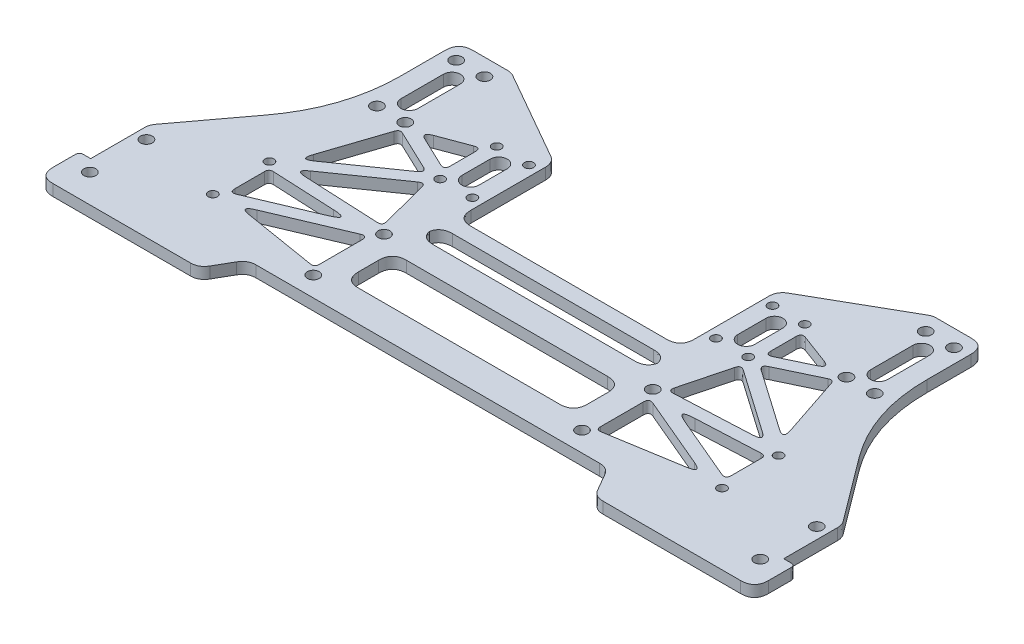
from build123d import *

# Parameters (mm, degrees)
SKETCH_1_W           = 186
SKETCH_1_H           = 115
SKETCH_1_R           = 2.1
EXTRUDE_1_DEPTH      = 4
SKETCH_2_R           = 2.1
CUT_EXTRUDE_1_DEPTH  = 219.716711753
CUT_EXTRUDE_2_DEPTH  = 219.716711753
SKETCH_6_R           = 1.6
SKETCH_6_W           = 73.2
SKETCH_6_H           = 45.2
CUT_EXTRUDE_4_DEPTH  = 219.716711753
SKETCH_10_W          = 79
SKETCH_10_H          = 54.2
CUT_EXTRUDE_6_DEPTH  = 219.716711753
SKETCH_12_W          = 33.5
SKETCH_12_H          = 35
EXTRUDE_3_DEPTH      = 4
SKETCH_13_W          = 4
SKETCH_13_H          = 20.7
CUT_EXTRUDE_7_DEPTH  = 248.833109168
EXTRUDE_4_DEPTH      = 4
SKETCH_15_R          = 1.6
CUT_EXTRUDE_8_DEPTH  = 248.833109168
SKETCH_16_W          = 81
SKETCH_16_H          = 17
SKETCH_16_H_2        = 6.8
CUT_EXTRUDE_9_DEPTH  = 248.833109168
CUT_EXTRUDE_10_DEPTH = 248.833109168
FILLET_1_SIZE        = 1.5
FILLET_2_SIZE        = 5
SKETCH_18_R          = 2.1
CUT_EXTRUDE_11_DEPTH = 248.833109305
FILLET_4_SIZE        = 0.1


with BuildPart() as part:
    # 草图1 → 凸台-拉伸1 (new body)
    with BuildSketch(Plane(origin=(0, 0, 0), x_dir=(1, 0, 0), z_dir=(0, 1, 0))):
        with Locations((93, -57.5)):
            Rectangle(SKETCH_1_W, SKETCH_1_H)
        with Locations(Location((5, -6, 0), (0, 0, 270))):
            Circle(SKETCH_1_R, mode=Mode.SUBTRACT)
        with Locations(Location((15, -6, 0), (0, 0, 90))):
            Circle(SKETCH_1_R, mode=Mode.SUBTRACT)
        with Locations(Location((15, -34, 0), (0, 0, 270))):
            Circle(SKETCH_1_R, mode=Mode.SUBTRACT)
        with Locations(Location((5, -34, 0), (0, 0, 90))):
            Circle(SKETCH_1_R, mode=Mode.SUBTRACT)
        with Locations(Location((171, -34, 0), (0, 0, 90))):
            Circle(SKETCH_1_R, mode=Mode.SUBTRACT)
        with Locations(Location((181, -34, 0), (0, 0, 270))):
            Circle(SKETCH_1_R, mode=Mode.SUBTRACT)
        with Locations(Location((171, -6, 0), (0, 0, 270))):
            Circle(SKETCH_1_R, mode=Mode.SUBTRACT)
        with Locations(Location((181, -6, 0), (0, 0, 90))):
            Circle(SKETCH_1_R, mode=Mode.SUBTRACT)
    extrude(amount=EXTRUDE_1_DEPTH)

    # 草图2 → 切除-拉伸1 (cut, through all)
    with BuildSketch(Plane(origin=(0, 4, 0), x_dir=(1, 0, 0), z_dir=(0, 1, 0))):
        with Locations(Location((45.5, -72, 0), (0, 0, 270))):
            Circle(SKETCH_2_R)
        with Locations(Location((45.5, -97, 0), (0, 0, 90))):
            Circle(SKETCH_2_R)
        with Locations(Location((140.5, -97, 0), (0, 0, 270))):
            Circle(SKETCH_2_R)
        with Locations(Location((140.5, -72, 0), (0, 0, 90))):
            Circle(SKETCH_2_R)
    extrude(amount=-CUT_EXTRUDE_1_DEPTH, mode=Mode.SUBTRACT)

    # 草图3 → 切除-拉伸2 (cut, through all)
    with BuildSketch(Plane(origin=(0, 4, 0), x_dir=(1, 0, 0), z_dir=(0, 1, 0))):
        Polygon((23, -115), (29.350852961, -104), (156.649147039, -104), (163, -115), align=None)
    extrude(amount=-CUT_EXTRUDE_2_DEPTH, mode=Mode.SUBTRACT)

    # 草图6 → 切除-拉伸4 (cut, through all)
    with BuildSketch(Plane(origin=(0, 4, 0), x_dir=(1, 0, 0), z_dir=(0, 1, 0))):
        with Locations(Location((49.95, -45.2, 0), (0, 0, 270))):
            Circle(SKETCH_6_R)
        with Locations(Location((49.95, -25.2, 0), (0, 0, 90))):
            Circle(SKETCH_6_R)
        with Locations(Location((147.45, -45.2, 0), (0, 0, 90))):
            Circle(SKETCH_6_R)
        with Locations(Location((147.45, -25.2, 0), (0, 0, 270))):
            Circle(SKETCH_6_R)
        with Locations(Location((136.05, -45.2, 0), (0, 0, 90))):
            Circle(SKETCH_6_R)
        with Locations(Location((136.05, -25.2, 0), (0, 0, 270))):
            Circle(SKETCH_6_R)
        with Locations(Location((38.55, -45.2, 0), (0, 0, 270))):
            Circle(SKETCH_6_R)
        with Locations(Location((38.55, -25.2, 0), (0, 0, 90))):
            Circle(SKETCH_6_R)
        with Locations((93, -21.6)):
            Rectangle(SKETCH_6_W, SKETCH_6_H)
    extrude(amount=-CUT_EXTRUDE_4_DEPTH, mode=Mode.SUBTRACT)

    # 草图10 → 切除-拉伸6 (cut, through all)
    with BuildSketch(Plane(origin=(0, 4, 0), x_dir=(1, 0, 0), z_dir=(0, 1, 0))):
        with Locations((93, -27.1)):
            Rectangle(SKETCH_10_W, SKETCH_10_H)
    extrude(amount=-CUT_EXTRUDE_6_DEPTH, mode=Mode.SUBTRACT)

    # 草图12 → 凸台-拉伸3 (add)
    with BuildSketch(Plane(origin=(0, 4, 0), x_dir=(1, 0, 0), z_dir=(0, 1, 0))):
        with Locations((-16.75, -97.5)):
            Rectangle(SKETCH_12_W, SKETCH_12_H)
        with Locations((202.75, -97.5)):
            Rectangle(SKETCH_12_W, SKETCH_12_H)
    extrude(amount=-EXTRUDE_3_DEPTH)

    # 草图13 → 切除-拉伸7 (cut, through all)
    with BuildSketch(Plane(origin=(0, 4, 0), x_dir=(1, 0, 0), z_dir=(0, 1, 0))):
        with Locations((-31.5, -90.35)):
            Rectangle(SKETCH_13_W, SKETCH_13_H)
        with Locations((217.5, -90.35)):
            Rectangle(SKETCH_13_W, SKETCH_13_H)
    extrude(amount=-CUT_EXTRUDE_7_DEPTH, mode=Mode.SUBTRACT)

    # 草图14 → 凸台-拉伸4 (add)
    with BuildSketch(Plane(origin=(0, 4, 0), x_dir=(1, 0, 0), z_dir=(0, 1, 0))):
        Polygon((-29.5, -80), (0, -40.5), (0, -80), align=None)
        Polygon((186, -40.5), (186, -80), (215.5, -80), align=None)
    extrude(amount=-EXTRUDE_4_DEPTH)

    # 草图15 → 切除-拉伸8 (cut, through all)
    with BuildSketch(Plane(origin=(0, 4, 0), x_dir=(1, 0, 0), z_dir=(0, 1, 0))):
        with Locations(Location((3, -90, 0), (0, 0, 270))):
            Circle(SKETCH_15_R)
        with Locations(Location((3, -70, 0), (0, 0, 270))):
            Circle(SKETCH_15_R)
        with Locations(Location((183, -90, 0), (0, 0, 90))):
            Circle(SKETCH_15_R)
        with Locations(Location((183, -70, 0), (0, 0, 90))):
            Circle(SKETCH_15_R)
    extrude(amount=-CUT_EXTRUDE_8_DEPTH, mode=Mode.SUBTRACT)

    # 草图16 → 切除-拉伸9 (cut, through all)
    with BuildSketch(Plane(origin=(0, 4, 0), x_dir=(1, 0, 0), z_dir=(0, 1, 0))):
        Polygon((18.5, 0), (53.5, 0), (53.5, -20), align=None)
        Polygon((132.5, 0), (132.5, -20), (167.5, 0), align=None)
        with BuildLine():
            Line((13, -12.5), (13, -27.5))
            ThreePointArc((13, -27.5), (10, -30.5), (7, -27.5))
            Line((7, -27.5), (7, -12.5))
            ThreePointArc((7, -12.5), (10, -9.5), (13, -12.5))
        make_face()
        with Locations((93, -84.5)):
            Rectangle(SKETCH_16_W, SKETCH_16_H)
        with BuildLine():
            Line((47.25, -30.2), (47.25, -40.2))
            ThreePointArc((47.25, -40.2), (44.25, -43.2), (41.25, -40.2))
            Line((41.25, -40.2), (41.25, -30.2))
            ThreePointArc((41.25, -30.2), (44.25, -27.2), (47.25, -30.2))
        make_face()
        with BuildLine():
            Line((138.75, -30.2), (138.75, -40.2))
            ThreePointArc((138.75, -40.2), (141.75, -43.2), (144.75, -40.2))
            Line((144.75, -40.2), (144.75, -30.2))
            ThreePointArc((144.75, -30.2), (141.75, -27.2), (138.75, -30.2))
        make_face()
        with Locations((93, -63.1)):
            Rectangle(SKETCH_16_W, SKETCH_16_H_2)
        with BuildLine():
            Line((173, -12.5), (173, -27.5))
            ThreePointArc((173, -27.5), (176, -30.5), (179, -27.5))
            Line((179, -27.5), (179, -12.5))
            ThreePointArc((179, -12.5), (176, -9.5), (173, -12.5))
        make_face()
    extrude(amount=-CUT_EXTRUDE_9_DEPTH, mode=Mode.SUBTRACT)

    # 草图17 → 切除-拉伸10 (cut, through all)
    with BuildSketch(Plane(origin=(0, 4, 0), x_dir=(1, 0, 0), z_dir=(0, 1, 0))):
        Polygon((43.3, -94.40800591), (10.851997517, -89.06362903), (43.3, -75.320945626), align=None)
        Polygon((5.2, -86.679054374), (35.742816938, -73.743273083), (5.2, -72.305964051), align=None)
        Polygon((42.620938362, -69.662080107), (9.559789006, -68.106261314), (37.214468055, -48.814108278), align=None)
        Polygon((7.186708526, -64.396885274), (34.187072468, -45.561188347), (16.300755426, -37.054744573), align=None)
        Polygon((142.7, -94.40800591), (142.7, -75.320945626), (175.148002483, -89.06362903), align=None)
        Polygon((180.8, -72.305964051), (180.8, -86.679054374), (150.257183062, -73.743273083), align=None)
        Polygon((143.379061638, -69.662080107), (148.785531945, -48.814108278), (176.440210994, -68.106261314), align=None)
        Polygon((169.699244574, -37.054744573), (178.813291474, -64.396885274), (151.812927532, -45.561188347), align=None)
        Polygon((20.633988795, -34.24330788), (36.35, -28.370658258), (36.35, -41.717589218), align=None)
        Polygon((149.65, -41.717589218), (165.366011205, -34.24330788), (149.65, -28.370658258), align=None)
    extrude(amount=-CUT_EXTRUDE_10_DEPTH, mode=Mode.SUBTRACT)

    # 圆角1
    # a fillet whose section is not a circle: 1.5 mm, written as the material it adds along each edge
    with BuildSketch(Plane(origin=(149.65, 4, 28.370658258), x_dir=(0, 0, 1), z_dir=(0, -1, 0))) as fillet_1_piece_1:
        with BuildLine():
            Bezier((2.161812449, 0), (0, 0), (0.756706639, -2.025050154), weights=[1, 1, 1])
            Line((0.756706639, -2.025050154), (0, 0))
            Line((0, 0), (2.161812449, 0))
        make_face()
    extrude(amount=4)
    with BuildSketch(Plane(origin=(165.366011205, 4, 34.24330788), x_dir=(-0.9030730537757868, 0, 0.4294869724963431), z_dir=(0, -1, 0))) as fillet_1_piece_2:
        with BuildLine():
            Bezier((3.54027343, 0), (0, 0), (2.462640144, 2.543410993), weights=[1, 1, 1])
            Line((2.462640144, 2.543410993), (0, 0))
            Line((0, 0), (3.54027343, 0))
        make_face()
    extrude(amount=4)
    with BuildSketch(Plane(origin=(149.65, 4, 41.717589218), x_dir=(0.903073053775787, 0, -0.42948697249634293), z_dir=(0, -1, 0)), Plane(origin=(36.35, 4, 41.717589218), x_dir=(0, 0, -1), z_dir=(0, -1, 0))) as fillet_1_piece_3:
        with BuildLine():
            Bezier((2.374370988, 0), (0, 0), (1.019761407, -2.144230459), weights=[1, 1, 1])
            Line((1.019761407, -2.144230459), (0, 0))
            Line((0, 0), (2.374370988, 0))
        make_face()
    extrude(amount=4)
    with BuildSketch(Plane(origin=(169.699244574, 4, 37.054744573), x_dir=(-0.9030730537757874, 0, 0.4294869724963422), z_dir=(0, -1, 0)), Plane(origin=(16.300755426, 4, 37.054744573), x_dir=(-0.31622776601683883, 0, 0.9486832980505134), z_dir=(0, -1, 0))) as fillet_1_piece_4:
        with BuildLine():
            Bezier((1.6954433, 0), (0, 0), (0.206624257, -1.682805515), weights=[1, 1, 1])
            Line((0.206624257, -1.682805515), (0, 0))
            Line((0, 0), (1.6954433, 0))
        make_face()
    extrude(amount=4)
    with BuildSketch(Plane(origin=(178.813291474, 4, 64.396885274), x_dir=(-0.8201521303534598, 0, -0.5721455086572659), z_dir=(0, -1, 0))) as fillet_1_piece_5:
        with BuildLine():
            Bezier((4.526955574, 0), (0, 0), (3.631251076, 2.703209646), weights=[1, 1, 1])
            Line((3.631251076, 2.703209646), (0, 0))
            Line((0, 0), (4.526955574, 0))
        make_face()
    extrude(amount=4)
    with BuildSketch(Plane(origin=(151.812927532, 4, 45.561188347), x_dir=(0.8201521303534597, 0, 0.572145508657266), z_dir=(0, -1, 0))) as fillet_1_piece_6:
        with BuildLine():
            Bezier((2.580624955, 0), (0, 0), (1.277224184, -2.24239237), weights=[1, 1, 1])
            Line((1.277224184, -2.24239237), (0, 0))
            Line((0, 0), (2.580624955, 0))
        make_face()
    extrude(amount=4)
    with BuildSketch(Plane(origin=(148.785531945, 4, 48.814108278), x_dir=(0.8201521303534596, 0, 0.5721455086572662), z_dir=(0, -1, 0))) as fillet_1_piece_7:
        with BuildLine():
            Bezier((2.156683083, 0), (0, 0), (0.750411903, 2.021920844), weights=[1, 1, 1])
            Line((0.750411903, 2.021920844), (0, 0))
            Line((0, 0), (2.156683083, 0))
        make_face()
    extrude(amount=4)
    with BuildSketch(Plane(origin=(143.379061638, 4, 69.662080107), x_dir=(0.9988945692351383, 0, -0.04700680325812128), z_dir=(0, -1, 0)), Plane(origin=(42.620938362, 4, 69.662080107), x_dir=(-0.2510248320612762, 0, -0.9679806473729773), z_dir=(0, -1, 0))) as fillet_1_piece_8:
        with BuildLine():
            Bezier((2.035757165, 0), (0, 0), (0.60309106, -1.944373526), weights=[1, 1, 1])
            Line((0.60309106, -1.944373526), (0, 0))
            Line((0, 0), (2.035757165, 0))
        make_face()
    extrude(amount=4)
    with BuildSketch(Plane(origin=(176.440210994, 4, 68.106261314), x_dir=(-0.8201521303534611, 0, -0.5721455086572641), z_dir=(0, -1, 0))) as fillet_1_piece_9:
        with BuildLine():
            Bezier((4.406944781, 0), (0, 0), (3.491846124, -2.688526166), weights=[1, 1, 1])
            Line((3.491846124, -2.688526166), (0, 0))
            Line((0, 0), (4.406944781, 0))
        make_face()
    extrude(amount=4)
    with BuildSketch(Plane(origin=(180.8, 4, 86.679054374), x_dir=(-0.9208176667771379, 0, -0.38999336475266827), z_dir=(0, -1, 0)), Plane(origin=(142.7, 4, 75.320945626), x_dir=(0.9208176667771379, 0, 0.38999336475266827), z_dir=(0, -1, 0))) as fillet_1_piece_10:
        with BuildLine():
            Bezier((2.264281108, 0), (0, 0), (0.883054608, 2.084990047), weights=[1, 1, 1])
            Line((0.883054608, 2.084990047), (0, 0))
            Line((0, 0), (2.264281108, 0))
        make_face()
    extrude(amount=4)
    with BuildSketch(Plane(origin=(180.8, 4, 72.305964051), x_dir=(-0.9988945692351379, 0, 0.04700680325812796), z_dir=(0, -1, 0)), Plane(origin=(5.2, 4, 72.305964051), x_dir=(0, 0, 1), z_dir=(0, -1, 0))) as fillet_1_piece_11:
        with BuildLine():
            Bezier((1.572248216, 0), (0, 0), (0.073906363, -1.570510205), weights=[1, 1, 1])
            Line((0.073906363, -1.570510205), (0, 0))
            Line((0, 0), (1.572248216, 0))
        make_face()
    extrude(amount=4)
    with BuildSketch(Plane(origin=(150.257183062, 4, 73.743273083), x_dir=(0.9208176667771378, 0, 0.38999336475266855), z_dir=(0, -1, 0))) as fillet_1_piece_12:
        with BuildLine():
            Bezier((6.589398734, 0), (0, 0), (5.940128311, -2.852201138), weights=[1, 1, 1])
            Line((5.940128311, -2.852201138), (0, 0))
            Line((0, 0), (6.589398734, 0))
        make_face()
    extrude(amount=4)
    with BuildSketch(Plane(origin=(175.148002483, 4, 89.06362903), x_dir=(-0.9208176667771376, 0, -0.3899933647526692), z_dir=(0, -1, 0))) as fillet_1_piece_13:
        with BuildLine():
            Bezier((5.178706703, 0), (0, 0), (4.377021827, -2.767793895), weights=[1, 1, 1])
            Line((4.377021827, -2.767793895), (0, 0))
            Line((0, 0), (5.178706703, 0))
        make_face()
    extrude(amount=4)
    with BuildSketch(Plane(origin=(142.7, 4, 94.40800591), x_dir=(0.9867058655781964, 0, -0.16251626021288462), z_dir=(0, -1, 0)), Plane(origin=(43.3, 4, 94.40800591), x_dir=(0, 0, -1), z_dir=(0, -1, 0))) as fillet_1_piece_14:
        with BuildLine():
            Bezier((1.767268698, 0), (0, 0), (0.2872099, -1.74377439), weights=[1, 1, 1])
            Line((0.2872099, -1.74377439), (0, 0))
            Line((0, 0), (1.767268698, 0))
        make_face()
    extrude(amount=4)
    with BuildSketch(Plane(origin=(43.3, 4, 75.320945626), x_dir=(-0.9208176667771362, 0, 0.3899933647526725), z_dir=(0, -1, 0)), Plane(origin=(5.2, 4, 86.679054374), x_dir=(0.9208176667771379, 0, -0.3899933647526681), z_dir=(0, -1, 0))) as fillet_1_piece_15:
        with BuildLine():
            Bezier((2.264281108, 0), (0, 0), (0.883054608, -2.084990047), weights=[1, 1, 1])
            Line((0.883054608, -2.084990047), (0, 0))
            Line((0, 0), (2.264281108, 0))
        make_face()
    extrude(amount=4)
    with BuildSketch(Plane(origin=(10.851997517, 4, 89.06362903), x_dir=(0.9208176667771376, 0, -0.38999336475266944), z_dir=(0, -1, 0))) as fillet_1_piece_16:
        with BuildLine():
            Bezier((5.178706703, 0), (0, 0), (4.377021827, 2.767793895), weights=[1, 1, 1])
            Line((4.377021827, 2.767793895), (0, 0))
            Line((0, 0), (5.178706703, 0))
        make_face()
    extrude(amount=4)
    with BuildSketch(Plane(origin=(35.742816938, 4, 73.743273083), x_dir=(-0.9208176667771377, 0, 0.389993364752669), z_dir=(0, -1, 0))) as fillet_1_piece_17:
        with BuildLine():
            Bezier((6.589398734, 0), (0, 0), (5.940128311, 2.852201138), weights=[1, 1, 1])
            Line((5.940128311, 2.852201138), (0, 0))
            Line((0, 0), (6.589398734, 0))
        make_face()
    extrude(amount=4)
    with BuildSketch(Plane(origin=(37.214468055, 4, 48.814108278), x_dir=(-0.8201521303534601, 0, 0.5721455086572653), z_dir=(0, -1, 0))) as fillet_1_piece_18:
        with BuildLine():
            Bezier((2.156683083, 0), (0, 0), (0.750411903, -2.021920844), weights=[1, 1, 1])
            Line((0.750411903, -2.021920844), (0, 0))
            Line((0, 0), (2.156683083, 0))
        make_face()
    extrude(amount=4)
    with BuildSketch(Plane(origin=(9.559789006, 4, 68.106261314), x_dir=(0.8201521303534604, 0, -0.572145508657265), z_dir=(0, -1, 0))) as fillet_1_piece_19:
        with BuildLine():
            Bezier((4.406944781, 0), (0, 0), (3.491846124, 2.688526166), weights=[1, 1, 1])
            Line((3.491846124, 2.688526166), (0, 0))
            Line((0, 0), (4.406944781, 0))
        make_face()
    extrude(amount=4)
    with BuildSketch(Plane(origin=(7.186708526, 4, 64.396885274), x_dir=(0.8201521303534605, 0, -0.5721455086572648), z_dir=(0, -1, 0))) as fillet_1_piece_20:
        with BuildLine():
            Bezier((4.526955574, 0), (0, 0), (3.631251076, -2.703209646), weights=[1, 1, 1])
            Line((3.631251076, -2.703209646), (0, 0))
            Line((0, 0), (4.526955574, 0))
        make_face()
    extrude(amount=4)
    with BuildSketch(Plane(origin=(34.187072468, 4, 45.561188347), x_dir=(-0.8201521303534588, 0, 0.5721455086572671), z_dir=(0, -1, 0))) as fillet_1_piece_21:
        with BuildLine():
            Bezier((2.580624955, 0), (0, 0), (1.277224184, 2.24239237), weights=[1, 1, 1])
            Line((1.277224184, 2.24239237), (0, 0))
            Line((0, 0), (2.580624955, 0))
        make_face()
    extrude(amount=4)
    with BuildSketch(Plane(origin=(36.35, 4, 28.370658258), x_dir=(0, 0, 1), z_dir=(0, -1, 0))) as fillet_1_piece_22:
        with BuildLine():
            Bezier((2.161812449, 0), (0, 0), (0.756706639, 2.025050154), weights=[1, 1, 1])
            Line((0.756706639, 2.025050154), (0, 0))
            Line((0, 0), (2.161812449, 0))
        make_face()
    extrude(amount=4)
    with BuildSketch(Plane(origin=(20.633988795, 4, 34.24330788), x_dir=(0.9030730537757878, 0, 0.42948697249634155), z_dir=(0, -1, 0))) as fillet_1_piece_23:
        with BuildLine():
            Bezier((3.54027343, 0), (0, 0), (2.462640144, -2.543410993), weights=[1, 1, 1])
            Line((2.462640144, -2.543410993), (0, 0))
            Line((0, 0), (3.54027343, 0))
        make_face()
    extrude(amount=4)
    # a fillet whose section is not a circle: 1.5 mm, written as the material it takes off along each edge
    with BuildSketch(Plane(origin=(-33.5, 7.75, 100.7), x_dir=(0, 0, 1), z_dir=(0, -1, 0))) as fillet_1_2_piece_1:
        with BuildLine():
            Bezier((FILLET_1_SIZE, 0), (0, 0), (0, -FILLET_1_SIZE), weights=[1, 1, 1])
            Line((0, -FILLET_1_SIZE), (0, 0))
            Line((0, 0), (FILLET_1_SIZE, 0))
        make_face()
    extrude(amount=11.5, mode=Mode.SUBTRACT)
    with BuildSketch(Plane(origin=(219.5, 7.75, 100.7), x_dir=(0, 0, 1), z_dir=(0, -1, 0))) as fillet_1_2_piece_2:
        with BuildLine():
            Bezier((FILLET_1_SIZE, 0), (0, 0), (0, FILLET_1_SIZE), weights=[1, 1, 1])
            Line((0, FILLET_1_SIZE), (0, 0))
            Line((0, 0), (FILLET_1_SIZE, 0))
        make_face()
    extrude(amount=11.5, mode=Mode.SUBTRACT)

    # 圆角2
    # a fillet whose section is not a circle: 5 mm, written as the material it adds along each edge
    with BuildSketch(Plane(origin=(29.350852961, 4, 104), x_dir=(1, 0, 0), z_dir=(0, -1, 0)), Plane(origin=(156.649147039, 4, 104), x_dir=(0.49999999999999956, 0, 0.8660254037844389), z_dir=(0, -1, 0))) as fillet_2_piece_1:
        with BuildLine():
            Bezier((2.886751346, 0), (0, 0), (-1.443375673, 2.5), weights=[1, 1, 1])
            Line((-1.443375673, 2.5), (0, 0))
            Line((0, 0), (2.886751346, 0))
        make_face()
    extrude(amount=4)
    with BuildSketch(Plane(origin=(53.5, 4, 54.2), x_dir=(0, 0, -1), z_dir=(0, -1, 0)), Plane(origin=(132.5, 4, 54.2), x_dir=(-1, 0, 0), z_dir=(0, -1, 0)), Plane(origin=(133.5, 4, 59.7), x_dir=(0, 0, 1), z_dir=(0, -1, 0)), Plane(origin=(52.5, 4, 59.7), x_dir=(1, 0, 0), z_dir=(0, -1, 0)), Plane(origin=(133.5, 4, 76), x_dir=(0, 0, 1), z_dir=(0, -1, 0)), Plane(origin=(133.5, 4, 93), x_dir=(-1, 0, 0), z_dir=(0, -1, 0))) as fillet_2_piece_2:
        with BuildLine():
            Bezier((FILLET_2_SIZE, 0), (0, 0), (0, FILLET_2_SIZE), weights=[1, 1, 1])
            Line((0, FILLET_2_SIZE), (0, 0))
            Line((0, 0), (FILLET_2_SIZE, 0))
        make_face()
    extrude(amount=4)
    with BuildSketch(Plane(origin=(133.5, 4, 66.5), x_dir=(0, 0, -1), z_dir=(0, -1, 0)), Plane(origin=(52.5, 4, 66.5), x_dir=(1, 0, 0), z_dir=(0, -1, 0)), Plane(origin=(52.5, 4, 76), x_dir=(0, 0, 1), z_dir=(0, -1, 0)), Plane(origin=(52.5, 4, 93), x_dir=(1, 0, 0), z_dir=(0, -1, 0))) as fillet_2_piece_3:
        with BuildLine():
            Bezier((FILLET_2_SIZE, 0), (0, 0), (0, -FILLET_2_SIZE), weights=[1, 1, 1])
            Line((0, -FILLET_2_SIZE), (0, 0))
            Line((0, 0), (FILLET_2_SIZE, 0))
        make_face()
    extrude(amount=4)
    # a fillet whose section is not a circle: 5 mm, written as the material it takes off along each edge
    with BuildSketch(Plane(origin=(23, 11.216878365, 115), x_dir=(0.4999999999999974, 0, -0.8660254037844402), z_dir=(0, -1, 0)), Plane(origin=(163, 11.216878365, 115), x_dir=(1, 0, 0), z_dir=(0, -1, 0))) as fillet_2_2_piece_1:
        with BuildLine():
            Bezier((2.886751346, 0), (0, 0), (-1.443375673, -2.5), weights=[1, 1, 1])
            Line((-1.443375673, -2.5), (0, 0))
            Line((0, 0), (2.886751346, 0))
        make_face()
    extrude(amount=18.43375673, mode=Mode.SUBTRACT)
    with BuildSketch(Plane(origin=(219.5, 16.5, 115), x_dir=(0, 0, -1), z_dir=(0, -1, 0))) as fillet_2_2_piece_2:
        with BuildLine():
            Bezier((FILLET_2_SIZE, 0), (0, 0), (0, -FILLET_2_SIZE), weights=[1, 1, 1])
            Line((0, -FILLET_2_SIZE), (0, 0))
            Line((0, 0), (FILLET_2_SIZE, 0))
        make_face()
    extrude(amount=29, mode=Mode.SUBTRACT)
    with BuildSketch(Plane(origin=(-33.5, 16.5, 115), x_dir=(0, 0, -1), z_dir=(0, -1, 0)), Plane(origin=(0, -12.5, 0), x_dir=(0, 0, 1), z_dir=(0, 1, 0)), Plane(origin=(186, -12.5, 0), x_dir=(-1, 0, 0), z_dir=(0, 1, 0))) as fillet_2_2_piece_3:
        with BuildLine():
            Bezier((FILLET_2_SIZE, 0), (0, 0), (0, FILLET_2_SIZE), weights=[1, 1, 1])
            Line((0, FILLET_2_SIZE), (0, 0))
            Line((0, 0), (FILLET_2_SIZE, 0))
        make_face()
    extrude(amount=29, mode=Mode.SUBTRACT)
    with BuildSketch(Plane(origin=(-29.5, 8.152585347, 80), x_dir=(0, 0, 1), z_dir=(0, -1, 0)), Plane(origin=(215.5, 8.152585347, 80), x_dir=(-0.5983760509703133, 0, -0.8012153902822716), z_dir=(0, -1, 0))) as fillet_2_2_piece_4:
        with BuildLine():
            Bezier((1.661034139, 0), (0, 0), (-1.330846116, -0.993923049), weights=[1, 1, 1])
            Line((-1.330846116, -0.993923049), (0, 0))
            Line((0, 0), (1.661034139, 0))
        make_face()
    extrude(amount=12.305170695, mode=Mode.SUBTRACT)
    with BuildSketch(Plane(origin=(18.5, 7.319555463, 0), x_dir=(-1, 0, 0), z_dir=(0, -1, 0)), Plane(origin=(167.5, 7.319555463, 0), x_dir=(-0.8682431421244566, 0, 0.49613893835683825), z_dir=(0, -1, 0))) as fillet_2_2_piece_5:
        with BuildLine():
            Bezier((1.327822185, 0), (0, 0), (-1.152872506, -0.658784289), weights=[1, 1, 1])
            Line((-1.152872506, -0.658784289), (0, 0))
            Line((0, 0), (1.327822185, 0))
        make_face()
    extrude(amount=10.639110927, mode=Mode.SUBTRACT)
    with BuildSketch(Plane(origin=(53.5, 11.254031693, 20), x_dir=(-0.8682431421244591, 0, -0.4961389383568339), z_dir=(0, -1, 0)), Plane(origin=(132.5, 11.254031693, 20), x_dir=(0, 0, 1), z_dir=(0, -1, 0))) as fillet_2_2_piece_6:
        with BuildLine():
            Bezier((2.901612677, 0), (0, 0), (-1.439603033, -2.519305308), weights=[1, 1, 1])
            Line((-1.439603033, -2.519305308), (0, 0))
            Line((0, 0), (2.901612677, 0))
        make_face()
    extrude(amount=18.508063387, mode=Mode.SUBTRACT)

    # 草图18 → 切除-拉伸11 (cut, through all)
    with BuildSketch(Plane(origin=(0, 4, 0), x_dir=(1, 0, 0), z_dir=(0, 1, 0))):
        with Locations(Location((-25.5, -105, 0), (0, 0, 270))):
            Circle(SKETCH_18_R)
        with Locations(Location((-25.5, -85, 0), (0, 0, 270))):
            Circle(SKETCH_18_R)
        with Locations(Location((211.5, -85, 0), (0, 0, 270))):
            Circle(SKETCH_18_R)
        with Locations(Location((211.5, -105, 0), (0, 0, 270))):
            Circle(SKETCH_18_R)
    extrude(amount=-CUT_EXTRUDE_11_DEPTH, mode=Mode.SUBTRACT)

    # 圆角3
    # a fillet whose section is not a circle: 60 mm, written as the material it adds along each edge
    with BuildSketch(Plane(origin=(0, 4, 40.5), x_dir=(0, 0, -1), z_dir=(0, -1, 0))) as fillet_3_piece_1:
        with BuildLine():
            Bezier((19.932409667, 0), (0, 0), (-15.970153391, -11.927076583), weights=[1, 1, 1])
            Line((-15.970153391, -11.927076583), (0, 0))
            Line((0, 0), (19.932409667, 0))
        make_face()
    extrude(amount=4)
    with BuildSketch(Plane(origin=(186, 4, 40.5), x_dir=(0, 0, -1), z_dir=(0, -1, 0))) as fillet_3_piece_2:
        with BuildLine():
            Bezier((19.932409667, 0), (0, 0), (-15.970153391, 11.927076583), weights=[1, 1, 1])
            Line((-15.970153391, 11.927076583), (0, 0))
            Line((0, 0), (19.932409667, 0))
        make_face()
    extrude(amount=4)

    # 圆角4
    # a fillet whose section is not a circle: 0.1 mm, written as the material it adds along each edge
    with BuildSketch(Plane(origin=(215.5, 4, 100.7), x_dir=(1, 0, 0), z_dir=(0, -1, 0)), Plane(origin=(-29.5, 4, 100.7), x_dir=(0, 0, -1), z_dir=(0, -1, 0))) as fillet_4_piece_1:
        with BuildLine():
            Bezier((FILLET_4_SIZE, 0), (0, 0), (0, -FILLET_4_SIZE), weights=[1, 1, 1])
            Line((0, -FILLET_4_SIZE), (0, 0))
            Line((0, 0), (FILLET_4_SIZE, 0))
        make_face()
    extrude(amount=4)


solid = part.part
